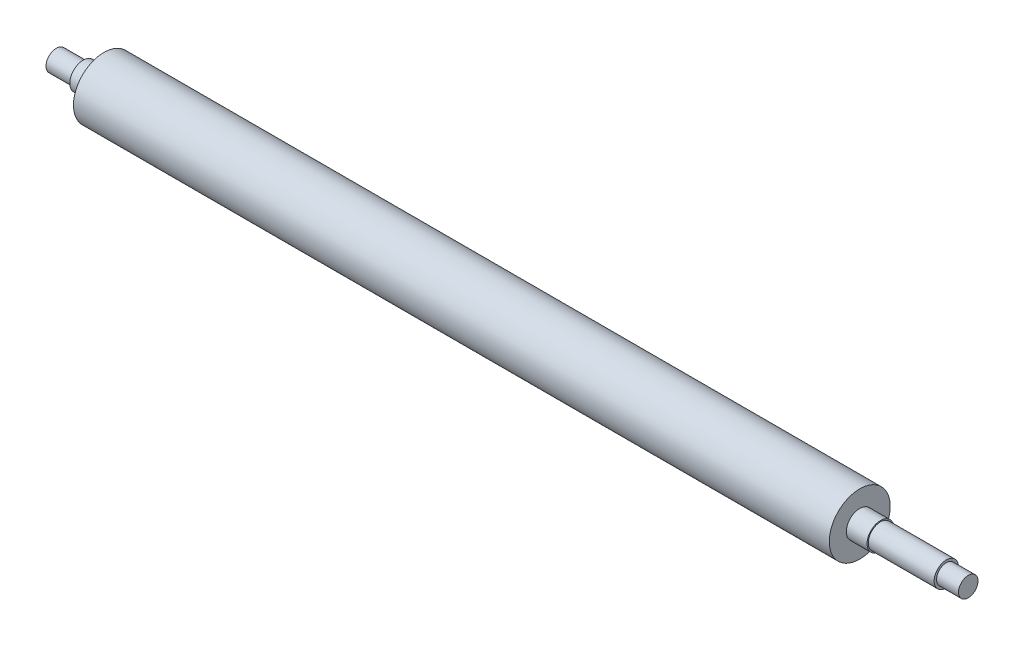
from build123d import *

# Parameters (mm, degrees)
CUT_EXTRUDE_1_DEPTH = 3.5


with BuildPart() as part:
    # 草图1 → 旋转1 (revolve)
    with BuildSketch(Plane.XY):
        Polygon((-310, 25), (310, 25), (310, 11), (327, 11), (327, 10), (381, 10), (381, 8), (399, 8), (399, 0), (-349, 0), (-349, 8.5), (-327, 8.5), (-327, 11), (-310, 11), align=None)
    revolve(axis=Axis((-349, 0, 0), (1, 0, 0)))

    # 草图3 → 切除-拉伸1 (cut)
    with BuildSketch(Plane(origin=(0, -8, 0), x_dir=(-1, 0, 0), z_dir=(0, -1, 0))):
        with BuildLine():
            Line((-394, 3), (-386, 3))
            ThreePointArc((-386, 3), (-383, 0), (-386, -3))
            Line((-386, -3), (-394, -3))
            ThreePointArc((-394, -3), (-397, 0), (-394, 3))
        make_face()
    extrude(amount=-CUT_EXTRUDE_1_DEPTH, mode=Mode.SUBTRACT)


solid = part.part
